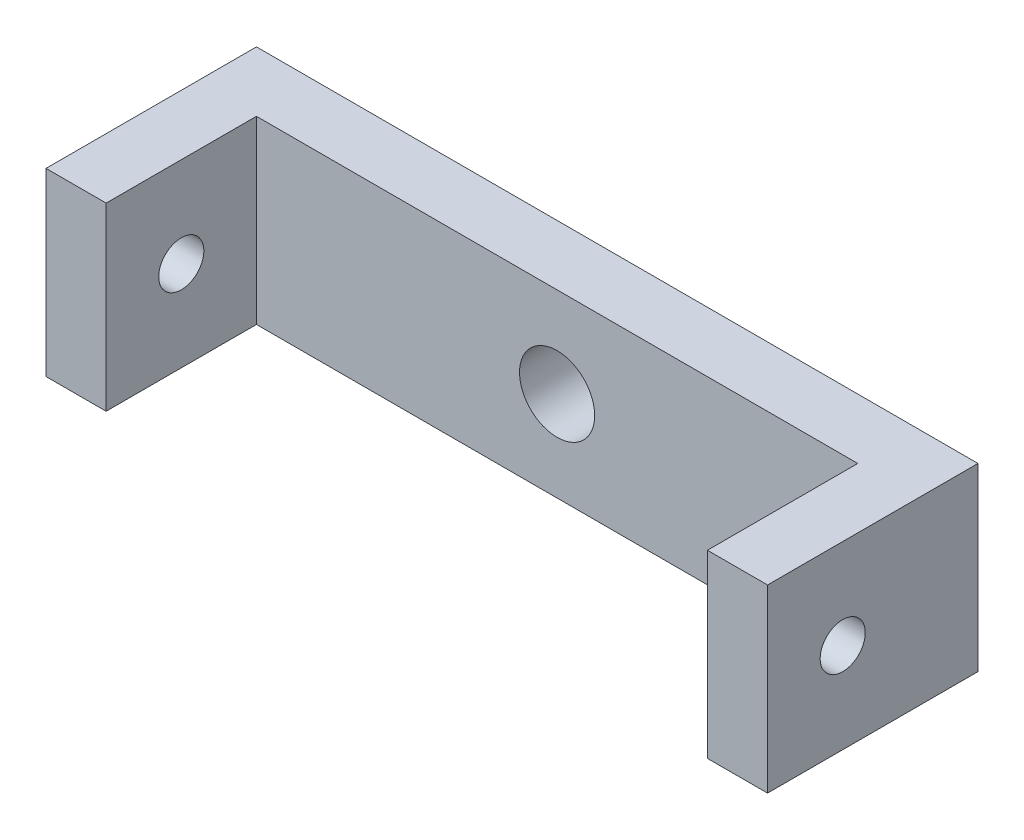
from build123d import *

# Parameters (mm, degrees)
SKETCH2_W               = 48
SKETCH2_H               = 11.994
SKETCH2_R               = 2.5
BOSS_EXTRUDE1_DEPTH     = 4
SKETCH3_W               = 4
SKETCH3_H               = 11.994
BOSS_EXTRUDE2_DEPTH     = 10
CUT_EXTRUDE1_DEPTH      = 62.061433285
CUT_EXTRUDE1_DEPTH_BACK = 62.061433285
SKETCH4_R               = 1.5


with BuildPart() as part:
    # Sketch2 → Boss-Extrude1 (new body)
    with BuildSketch(Plane.XY.offset(-19)):
        with Locations((4.728538795, -31.838150783)):
            Rectangle(SKETCH2_W, SKETCH2_H)
        with Locations((4.728538795, -31.838150783)):
            Circle(SKETCH2_R, mode=Mode.SUBTRACT)
    extrude(amount=BOSS_EXTRUDE1_DEPTH)

    # Sketch3 → Boss-Extrude2 (add)
    with BuildSketch(Plane.XY.offset(-15)):
        with Locations((26.728538795, -31.838150783)):
            Rectangle(SKETCH3_W, SKETCH3_H)
        with Locations((-17.271461205, -31.838150783)):
            Rectangle(SKETCH3_W, SKETCH3_H)
    extrude(amount=BOSS_EXTRUDE2_DEPTH)

    # Sketch4 → Cut-Extrude1 (cut, two sides: drawn at the far end of the back side and taken through both)
    with BuildSketch(Plane.ZY.offset(-24.728538795).offset(-CUT_EXTRUDE1_DEPTH_BACK)):
        with Locations((-10, -31.838150783)):
            Circle(SKETCH4_R)
    extrude(amount=CUT_EXTRUDE1_DEPTH + CUT_EXTRUDE1_DEPTH_BACK, mode=Mode.SUBTRACT)


solid = part.part
